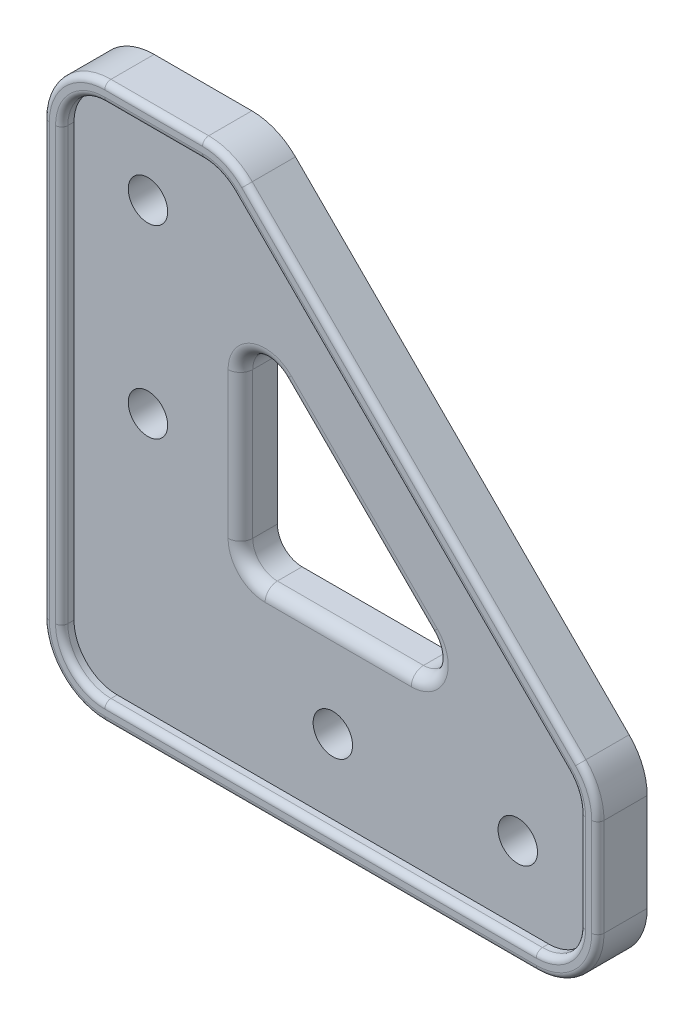
from build123d import *

# Parameters (mm, degrees)
BOSS_EXTRUDE1_DEPTH = 3
SKETCH2_R           = 1.6
CUT_EXTRUDE1_DEPTH  = 64.710281745
BOSS_EXTRUDE2_DEPTH = 1
FILLET1_R           = 0.5
CUT_EXTRUDE2_DEPTH  = 64.710281745
FILLET2_R           = 1


with BuildPart() as part:
    # Sketch1 → Boss-Extrude1 (new body)
    with BuildSketch(Plane.XY):
        with BuildLine():
            Line((16.464466094, 43.535533906), (43.535533906, 16.464466094))
            ThreePointArc((43.535533906, 16.464466094), (44.619397663, 14.84234935), (45, 12.928932188))
            Line((45, 12.928932188), (45, 5))
            ThreePointArc((45, 5), (43.535533906, 1.464466094), (40, 0))
            Line((40, 0), (5, 0))
            ThreePointArc((5, 0), (1.464466094, 1.464466094), (0, 5))
            Line((0, 5), (0, 40))
            ThreePointArc((0, 40), (1.464466094, 43.535533906), (5, 45))
            Line((5, 45), (12.928932188, 45))
            ThreePointArc((12.928932188, 45), (14.84234935, 44.619397663), (16.464466094, 43.535533906))
        make_face()
    extrude(amount=BOSS_EXTRUDE1_DEPTH)

    # Sketch2 → Cut-Extrude1 (cut, through all)
    with BuildSketch(Plane.XY.offset(3)):
        with Locations((7.5, 37.5)):
            Circle(SKETCH2_R)
        with Locations((7.5, 22.5)):
            Circle(SKETCH2_R)
        with Locations((22.5, 7.5)):
            Circle(SKETCH2_R)
        with Locations((37.5, 7.5)):
            Circle(SKETCH2_R)
    extrude(amount=-CUT_EXTRUDE1_DEPTH, mode=Mode.SUBTRACT)

    # Sketch3 → Boss-Extrude2 (add)
    with BuildSketch(Plane.XY.offset(3)):
        with BuildLine():
            Line((5, 0), (40, 0))
            ThreePointArc((40, 0), (43.535533906, 1.464466094), (45, 5))
            Line((45, 5), (45, 12.928932188))
            ThreePointArc((45, 12.928932188), (44.619397663, 14.84234935), (43.535533906, 16.464466094))
            Line((43.535533906, 16.464466094), (16.464466094, 43.535533906))
            ThreePointArc((16.464466094, 43.535533906), (14.84234935, 44.619397663), (12.928932188, 45))
            Line((12.928932188, 45), (5, 45))
            ThreePointArc((5, 45), (1.464466094, 43.535533906), (0, 40))
            Line((0, 40), (0, 5))
            ThreePointArc((0, 5), (1.464466094, 1.464466094), (5, 0))
        make_face()
        with BuildLine():
            Line((5, 1.5), (40, 1.5))
            ThreePointArc((40, 1.5), (42.474873734, 2.525126266), (43.5, 5))
            Line((43.5, 5), (43.5, 12.928932188))
            ThreePointArc((43.5, 12.928932188), (43.233578364, 14.268324201), (42.474873734, 15.403805922))
            Line((42.474873734, 15.403805922), (15.403805922, 42.474873734))
            ThreePointArc((15.403805922, 42.474873734), (14.268324201, 43.233578364), (12.928932188, 43.5))
            Line((12.928932188, 43.5), (5, 43.5))
            ThreePointArc((5, 43.5), (2.525126266, 42.474873734), (1.5, 40))
            Line((1.5, 40), (1.5, 5))
            ThreePointArc((1.5, 5), (2.525126266, 2.525126266), (5, 1.5))
        make_face(mode=Mode.SUBTRACT)
    extrude(amount=BOSS_EXTRUDE2_DEPTH)

    # Fillet1
    fillet1_edges = [part.edges().sort_by_distance(p)[0] for p in [
        (42.474873734, 2.525126266, 4),
        (43.5, 8.964466094, 4),
        (43.233578364, 14.268324201, 4),
        (28.939339828, 28.939339828, 4),
        (14.268324201, 43.233578364, 4),
        (8.964466094, 43.5, 4),
        (2.525126266, 42.474873734, 4),
        (1.5, 22.5, 4),
        (2.525126266, 2.525126266, 4),
        (22.5, 1.5, 4),
        (0, 22.5, 4),
        (1.464466094, 43.535533906, 4),
        (8.964466094, 45, 4),
        (14.84234935, 44.619397663, 4),
        (30, 30, 4),
        (44.619397663, 14.84234935, 4),
        (45, 8.964466094, 4),
        (43.535533906, 1.464466094, 4),
        (22.5, 0, 4),
        (1.464466094, 1.464466094, 4),
    ]]
    fillet(fillet1_edges, radius=FILLET1_R)

    # Sketch4 → Cut-Extrude2 (cut, through all)
    with BuildSketch(Plane.XY.offset(3)):
        with BuildLine():
            Line((15, 28.857864376), (15, 17))
            ThreePointArc((15, 17), (15.585786438, 15.585786438), (17, 15))
            Line((17, 15), (28.857864376, 15))
            ThreePointArc((28.857864376, 15), (30.705623441, 16.234633135), (30.272077939, 18.414213562))
            Line((30.272077939, 18.414213562), (18.414213562, 30.272077939))
            ThreePointArc((18.414213562, 30.272077939), (16.234633135, 30.705623441), (15, 28.857864376))
        make_face()
    extrude(amount=-CUT_EXTRUDE2_DEPTH, mode=Mode.SUBTRACT)

    # Fillet2
    fillet2_edges = [part.edges().sort_by_distance(p)[0] for p in [
        (15.585786438, 15.585786438, 3),
        (22.928932188, 15, 3),
        (30.705623441, 16.234633135, 3),
        (24.343145751, 24.343145751, 3),
        (16.234633135, 30.705623441, 3),
        (15, 22.928932188, 3),
    ]]
    fillet(fillet2_edges, radius=FILLET2_R)


solid = part.part
